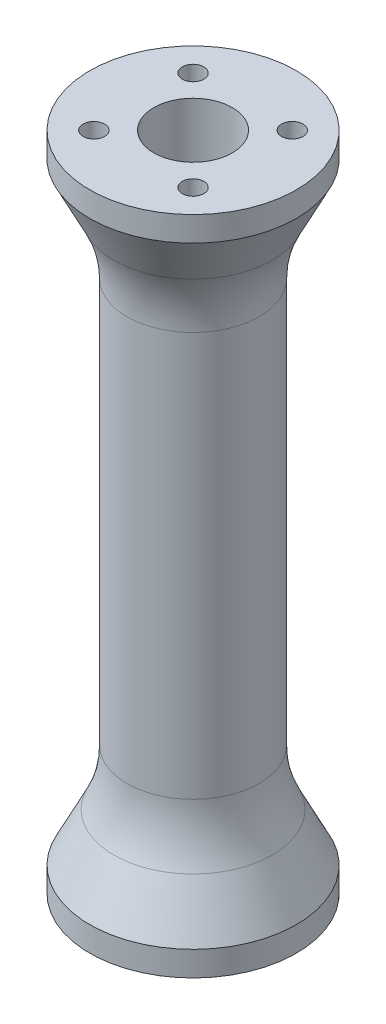
from build123d import *

# Parameters (mm, degrees)
SKETCH2_R          = 1.3
CUT_EXTRUDE1_DEPTH = 7
SKETCH4_R          = 4.75
CUT_EXTRUDE2_DEPTH = 82.929848041
FILLET1_R          = 15
FILLET2_R          = 4


with BuildPart() as part:
    # Sketch1 → Revolve1 (revolve)
    with BuildSketch(Plane.XY):
        Polygon((0, -40), (0, 40), (-12.5, 40), (-12.5, 37), (-8, 28), (-8, -28), (-12.5, -37), (-12.5, -40), align=None)
    revolve(axis=Axis((0, -40, 0), (0, 1, 0)))

    # Sketch2 → Cut-Extrude1 (cut)
    with BuildSketch(Plane(origin=(0, 40, 0), x_dir=(1, 0, 0), z_dir=(0, 1, 0))):
        with Locations((-6, 6)):
            Circle(SKETCH2_R)
        with Locations((6, 6)):
            Circle(SKETCH2_R)
        with Locations((-6, -6)):
            Circle(SKETCH2_R)
        with Locations((6, -6)):
            Circle(SKETCH2_R)
    cut_extrude1 = extrude(amount=-CUT_EXTRUDE1_DEPTH, mode=Mode.SUBTRACT)

    # Mirror1: Cut-Extrude1 across plane
    add(cut_extrude1.mirror(Plane.ZX), mode=Mode.SUBTRACT)

    # Sketch3 → Cut-Revolve1 (revolve, cut)
    with BuildSketch(Plane(origin=(0, 0, 0), x_dir=(0, 0, -1), z_dir=(1, 0, 0))):
        Polygon((-7, 29.7), (0, 36.7), (0, -36.7), (-7, -29.7), align=None)
    revolve(axis=Axis((0, 36.7, 0), (0, -1, 0)), mode=Mode.SUBTRACT)

    # Sketch4 → Cut-Extrude2 (cut, through all)
    with BuildSketch(Plane(origin=(0, 40, 0), x_dir=(1, 0, 0), z_dir=(0, 1, 0))):
        Circle(SKETCH4_R)
    extrude(amount=-CUT_EXTRUDE2_DEPTH, mode=Mode.SUBTRACT)

    # Fillet1
    fillet1_edges = [part.edges().sort_by_distance(p)[0] for p in [
        (8, 28, 0),
        (8, -28, 0),
    ]]
    fillet(fillet1_edges, radius=FILLET1_R)

    # Fillet2
    fillet2_edges = [part.edges().sort_by_distance(p)[0] for p in [
        (0, -29.7, -7),
        (0, 29.7, -7),
    ]]
    fillet(fillet2_edges, radius=FILLET2_R)


solid = part.part
